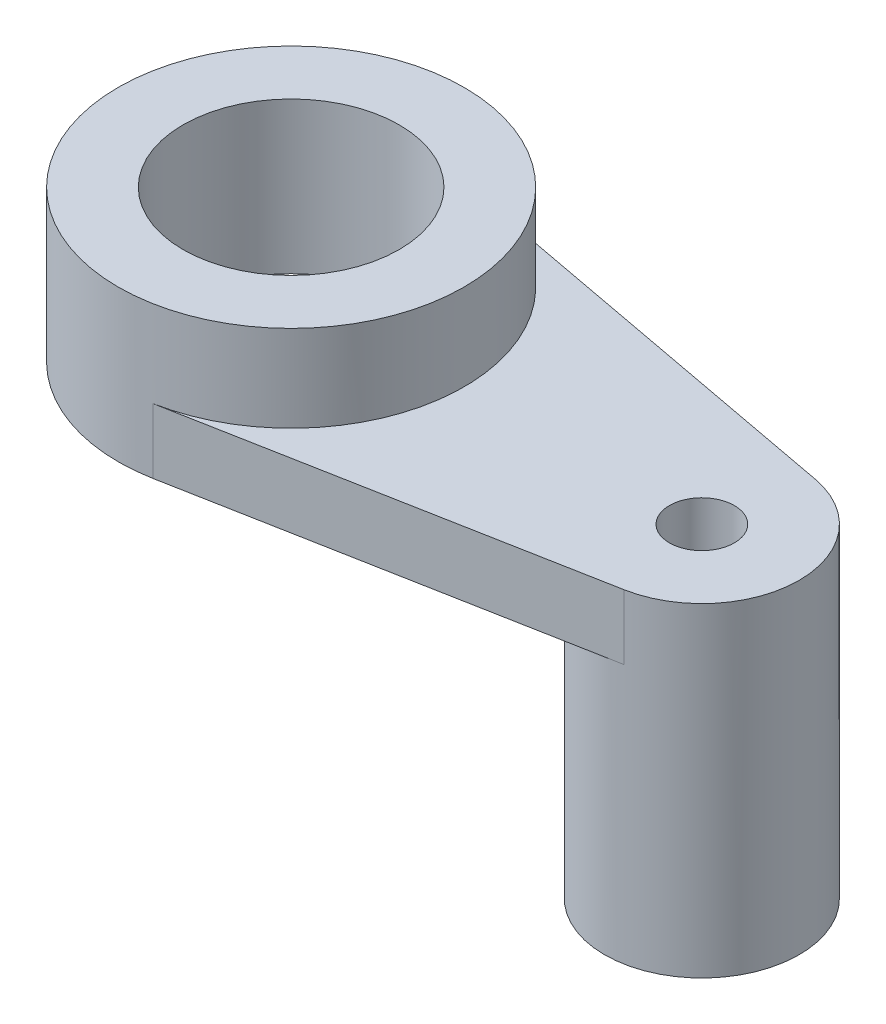
from build123d import *

# Parameters (mm, degrees)
SKETCH1_R           = 3
SKETCH1_R_2         = 10
BOSS_EXTRUDE1_DEPTH = 6
SKETCH1_3_R         = 10
BOSS_EXTRUDE2_DEPTH = 14
BOSS_EXTRUDE3_START = -24
SKETCH1_4_R         = 3
BOSS_EXTRUDE3_DEPTH = 24


with BuildPart() as part:
    # Sketch1 → Boss-Extrude1 (new body)
    with BuildSketch(Plane(origin=(0, 0, 0), x_dir=(1, 0, 0), z_dir=(0, 1, 0))):
        with BuildLine():
            Line((39.657894737, 8.845981293), (2.947368421, 15.726188966))
            ThreePointArc((2.947368421, 15.726188966), (-16, 0), (2.947368421, -15.726188966))
            Line((2.947368421, -15.726188966), (39.657894737, -8.845981293))
            ThreePointArc((39.657894737, -8.845981293), (47, 0), (39.657894737, 8.845981293))
        make_face()
        with Locations((38, 0)):
            Circle(SKETCH1_R, mode=Mode.SUBTRACT)
        Circle(SKETCH1_R_2, mode=Mode.SUBTRACT)
    extrude(amount=BOSS_EXTRUDE1_DEPTH)

    # Sketch1<3> → Boss-Extrude2 (add)
    with BuildSketch(Plane(origin=(0, 0, 0), x_dir=(1, 0, 0), z_dir=(0, 1, 0))):
        with BuildLine():
            ThreePointArc((16, 0), (12.311740225, 10.218661979), (2.947368421, 15.726188966))
            ThreePointArc((2.947368421, 15.726188966), (-16, 0), (2.947368421, -15.726188966))
            ThreePointArc((2.947368421, -15.726188966), (12.311740225, -10.218661979), (16, 0))
        make_face()
        Circle(SKETCH1_3_R, mode=Mode.SUBTRACT)
    extrude(amount=BOSS_EXTRUDE2_DEPTH)

    # Sketch1<4> → Boss-Extrude3 (add)
    with BuildSketch(Plane(origin=(0, 0, 0), x_dir=(1, 0, 0), z_dir=(0, 1, 0)).offset(BOSS_EXTRUDE3_START)):
        with BuildLine():
            ThreePointArc((47, 0), (44.925353877, 5.747997363), (39.657894737, 8.845981293))
            ThreePointArc((39.657894737, 8.845981293), (29, 0), (39.657894737, -8.845981293))
            ThreePointArc((39.657894737, -8.845981293), (44.925353877, -5.747997363), (47, 0))
        make_face()
        with Locations((38, 0)):
            Circle(SKETCH1_4_R, mode=Mode.SUBTRACT)
    extrude(amount=BOSS_EXTRUDE3_DEPTH)


solid = part.part
